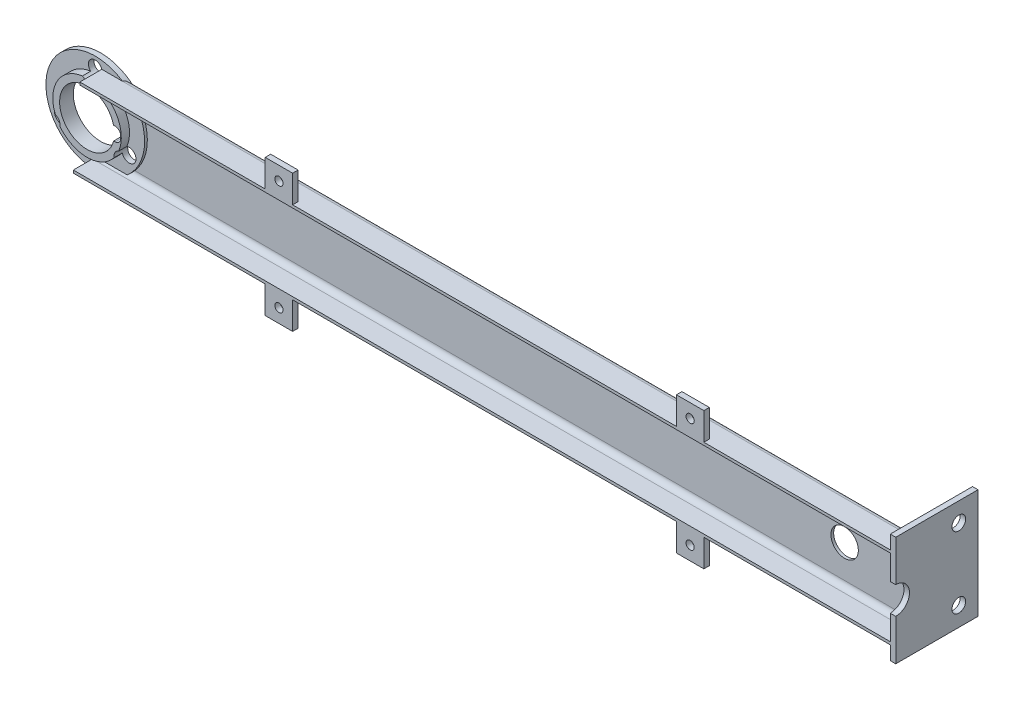
from build123d import *

# Parameters (mm, degrees)
BOSS_EXTRUDE1_DEPTH     = 300
SKETCH2_W               = 10
SKETCH2_H               = 10
BOSS_EXTRUDE2_DEPTH     = 2
SKETCH4_R               = 18
SKETCH4_R_2             = 15
SKETCH4_R_3             = 10
BOSS_EXTRUDE3_DEPTH     = 2
SKETCH4_3_R             = 10
CUT_EXTRUDE1_DEPTH      = 2
BOSS_EXTRUDE4_START     = -5
BOSS_EXTRUDE4_OUTLINE_R = 12.5
BOSS_EXTRUDE4_DEPTH     = 3
CUT_EXTRUDE2_START      = -2
CUT_EXTRUDE2_DEPTH      = 2
F_3_0MM_DOWEL_HOLE1_D   = 3
SKETCH8_R               = 2.5
BOSS_EXTRUDE5_DEPTH     = 2
SKETCH9_R               = 5
CUT_EXTRUDE3_DEPTH      = 32
SKETCH10_R              = 2.5
CUT_EXTRUDE4_DEPTH      = 10


# Read off the part's stored shape, not the designer's step: Boss-Extrude4, Cut-Extrude2
with BuildPart() as part:
    # Sketch1 → Boss-Extrude1 (new body)
    with BuildSketch(Plane(origin=(0, 0, 0), x_dir=(0, 0, -1), z_dir=(1, 0, 0))):
        with BuildLine():
            Line((10, 13), (10, -13))
            ThreePointArc((10, -13), (9.414213562, -14.414213562), (8, -15))
            Line((8, -15), (0, -15))
            Line((0, -15), (0, -14))
            Line((0, -14), (7, -14))
            ThreePointArc((7, -14), (8.414213562, -13.414213562), (9, -12))
            Line((9, -12), (9, 12))
            ThreePointArc((9, 12), (8.414213562, 13.414213562), (7, 14))
            Line((7, 14), (0, 14))
            Line((0, 14), (0, 15))
            Line((0, 15), (8, 15))
            ThreePointArc((8, 15), (9.414213562, 14.414213562), (10, 13))
        make_face()
    extrude(amount=BOSS_EXTRUDE1_DEPTH)

    # Sketch2 → Boss-Extrude2 (add)
    with BuildSketch(Plane.XY):
        with Locations((75, 20)):
            Rectangle(SKETCH2_W, SKETCH2_H)
        with Locations((75, -20)):
            Rectangle(SKETCH2_W, SKETCH2_H)
        with Locations((225, 20)):
            Rectangle(SKETCH2_W, SKETCH2_H)
        with Locations((225, -20)):
            Rectangle(SKETCH2_W, SKETCH2_H)
    extrude(amount=-BOSS_EXTRUDE2_DEPTH)

    # Sketch4 → Boss-Extrude3 (add)
    # profile 1 of 2: a face of its own
    with BuildSketch(Plane(origin=(0, 0, -10), x_dir=(-1, 0, 0), z_dir=(0, 0, -1))):
        Circle(SKETCH4_R)
        Circle(SKETCH4_R_2, mode=Mode.SUBTRACT)
    # profile 2 of 2: a face of its own
    with BuildSketch(Plane(origin=(0, 0, -10), x_dir=(-1, 0, 0), z_dir=(0, 0, -1))):
        Circle(SKETCH4_R)
        with Locations(Location((0, 0, 0), (0, 0, 90))):
            Circle(SKETCH4_R_3, mode=Mode.SUBTRACT)
    extrude(amount=-BOSS_EXTRUDE3_DEPTH)

    # Sketch4<3> → Cut-Extrude1 (cut)
    with BuildSketch(Plane(origin=(0, 0, -10), x_dir=(-1, 0, 0), z_dir=(0, 0, -1))):
        with Locations(Location((0, 0, 0), (0, 0, 90))):
            Circle(SKETCH4_3_R)
    extrude(amount=-CUT_EXTRUDE1_DEPTH, mode=Mode.SUBTRACT)

    # Boss-Extrude4 outline → Boss-Extrude4 (add)
    with BuildSketch(Plane(origin=(0, 0, -10), x_dir=(-1, 0, 0), z_dir=(0, 0, -1)).offset(BOSS_EXTRUDE4_START)):
        Circle(BOSS_EXTRUDE4_OUTLINE_R)
        with BuildLine():
            ThreePointArc((-9.682458366, 2.5), (10, 0), (-9.682458366, -2.5))
            Line((-9.682458366, -2.5), (-10.25, -2.5))
            ThreePointArc((-10.25, -2.5), (-11.664213562, -1.914213562), (-12.25, -0.5))
            Line((-12.25, -0.5), (-12.25, 0.5))
            ThreePointArc((-12.25, 0.5), (-11.664213562, 1.914213562), (-10.25, 2.5))
            Line((-10.25, 2.5), (-9.682458366, 2.5))
        make_face(mode=Mode.SUBTRACT)
    extrude(amount=BOSS_EXTRUDE4_DEPTH)

    # Cut-Extrude2 outline → Cut-Extrude2 (cut)
    with BuildSketch(Plane(origin=(0, 0, -10), x_dir=(-1, 0, 0), z_dir=(0, 0, -1)).offset(CUT_EXTRUDE2_START)):
        with BuildLine():
            ThreePointArc((-10.25, 2.5), (-11.664213562, 1.914213562), (-12.25, 0.5))
            Line((-12.25, 0.5), (-12.25, -0.5))
            ThreePointArc((-12.25, -0.5), (-11.664213562, -1.914213562), (-10.25, -2.5))
            Line((-10.25, -2.5), (-9.682458366, -2.5))
            ThreePointArc((-9.682458366, -2.5), (-10, 0), (-9.682458366, 2.5))
            Line((-9.682458366, 2.5), (-10.25, 2.5))
        make_face()
    extrude(amount=CUT_EXTRUDE2_DEPTH, mode=Mode.SUBTRACT)

    # Ø3.0mm Dowel Hole1 (through all)
    with Locations(Plane.XY):
        with Locations((75, 20), (75, -20), (225, 20), (225, -20)):
            Hole(F_3_0MM_DOWEL_HOLE1_D / 2)

    # Sketch8 → Boss-Extrude5 (add)
    with BuildSketch(Plane(origin=(300, 0, 0), x_dir=(0, 0, -1), z_dir=(1, 0, 0))):
        with BuildLine():
            Line((0, -5), (0, -20))
            Line((0, -20), (30, -20))
            Line((30, -20), (30, 20))
            Line((30, 20), (0, 20))
            Line((0, 20), (0, 5))
            ThreePointArc((0, 5), (3.535533906, 3.535533906), (5, 0))
            ThreePointArc((5, 0), (3.535533906, -3.535533906), (0, -5))
        make_face()
        with Locations((23, -13)):
            Circle(SKETCH8_R, mode=Mode.SUBTRACT)
        with Locations((23, 13)):
            Circle(SKETCH8_R, mode=Mode.SUBTRACT)
    extrude(amount=-BOSS_EXTRUDE5_DEPTH)

    # Sketch9 → Cut-Extrude3 (cut)
    with BuildSketch(Plane.XY):
        with Locations((272.348806761, 0)):
            Circle(SKETCH9_R)
    extrude(amount=-CUT_EXTRUDE3_DEPTH, mode=Mode.SUBTRACT)

    # Sketch10 → Cut-Extrude4 (cut)
    with BuildSketch(Plane(origin=(0, 0, -10), x_dir=(-1, 0, 0), z_dir=(0, 0, -1))):
        with Locations(Location((0, 14.25, 0), (0, 0, 90))):
            Circle(SKETCH10_R)
        with Locations(Location((12.340862004, -7.125, 0), (0, 0, 90))):
            Circle(SKETCH10_R)
        with Locations(Location((-12.340862004, -7.125, 0), (0, 0, 90))):
            Circle(SKETCH10_R)
    extrude(amount=-CUT_EXTRUDE4_DEPTH, mode=Mode.SUBTRACT)


solid = part.part
